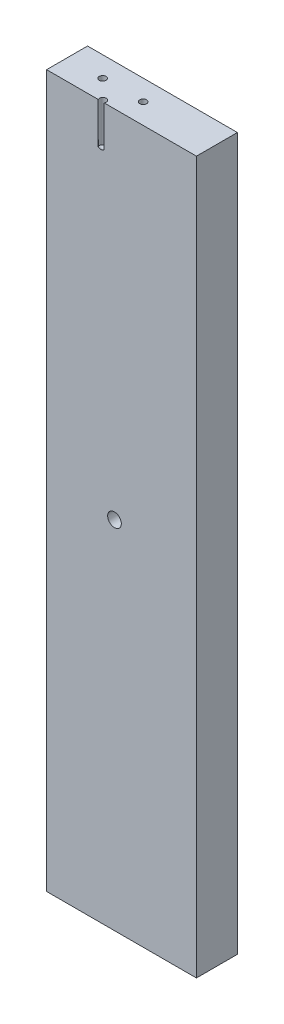
from build123d import *

# Parameters (mm, degrees)
SKETCH1_W                   = 69.666978681
SKETCH1_H                   = 330.949999988
BOSS_EXTRUDE1_DEPTH         = 19.05
HOLE3_D                     = 3.175
HOLE3_DEPTH                 = 38.1
HOLE3_CSINK_D               = 10.16
HOLE3_CSINK_ANGLE           = 82
HOLE3_TIP                   = 0.953866233
F_1_4_0_25_DIAMETER_HOLE1_D = 6.35
HOLE5_D                     = 3.175
HOLE5_DEPTH                 = 38.1
HOLE5_CSINK_D               = 10.16
HOLE5_CSINK_ANGLE           = 82
HOLE5_TIP                   = 0.953866233


with BuildPart() as part:
    # Sketch1 → Boss-Extrude1 (new body)
    with BuildSketch(Plane.XY):
        with Locations((244.186456522, -72.024999997)):
            Rectangle(SKETCH1_W, SKETCH1_H)
    extrude(amount=BOSS_EXTRUDE1_DEPTH)

    # Hole3
    with Locations(Plane(origin=(-181.039434513, 112.499999997, 395.011945614), x_dir=(0.9271838545667855, -1.3196841813264566e-15, -0.37460659341591657), z_dir=(0, 1, 0))):
        with Locations((46.221112845, 113.488854888), (39.39759596, 37.945520226), (412.28786892, 80.423559293), (407.308516105, 25.297013484), (513.561319184, 161.164706775), (597.46020397, 127.267357003), (610.543339245, 159.649253123), (694.322923815, 367.011001477), (526.644454459, 193.546602895), (610.424039029, 400.908351249)):
            CounterSinkHole(HOLE3_D / 2, HOLE3_CSINK_D / 2, depth=HOLE3_DEPTH, counter_sink_angle=HOLE3_CSINK_ANGLE)
            with Locations((0, 0, -(HOLE3_DEPTH + HOLE3_TIP / 2))):  # 118° drill point
                Cone(0, HOLE3_D / 2, HOLE3_TIP, mode=Mode.SUBTRACT)

    # 1/4 (0.25) Diameter Hole1 (through all)
    with Locations(Plane(origin=(0, 0, 0), x_dir=(-1, 0, 0), z_dir=(0, 0, -1))):
        with Locations((-240.919945862, -72.024999997)):
            Hole(F_1_4_0_25_DIAMETER_HOLE1_D / 2)

    # Hole5
    with Locations(Plane(origin=(-181.039434513, 112.499999997, 580.972905015), x_dir=(0.9271838545667913, -6.190403823971236e-15, -0.3746065934159023), z_dir=(0, 1, 0))):
        with Locations((36.640102895, 113.488854888), (29.81658601, 37.945520226), (402.70685897, 80.423559293), (397.727506155, 25.297013484), (508.602312063, 172.604565212), (526.095470081, 165.5368706), (539.178605356, 197.918766721), (608.840806866, 370.338765857), (521.685447338, 204.986461333), (591.347648847, 377.406460469)):
            CounterSinkHole(HOLE5_D / 2, HOLE5_CSINK_D / 2, depth=HOLE5_DEPTH, counter_sink_angle=HOLE5_CSINK_ANGLE)
            with Locations((0, 0, -(HOLE5_DEPTH + HOLE5_TIP / 2))):  # 118° drill point
                Cone(0, HOLE5_D / 2, HOLE5_TIP, mode=Mode.SUBTRACT)


solid = part.part
